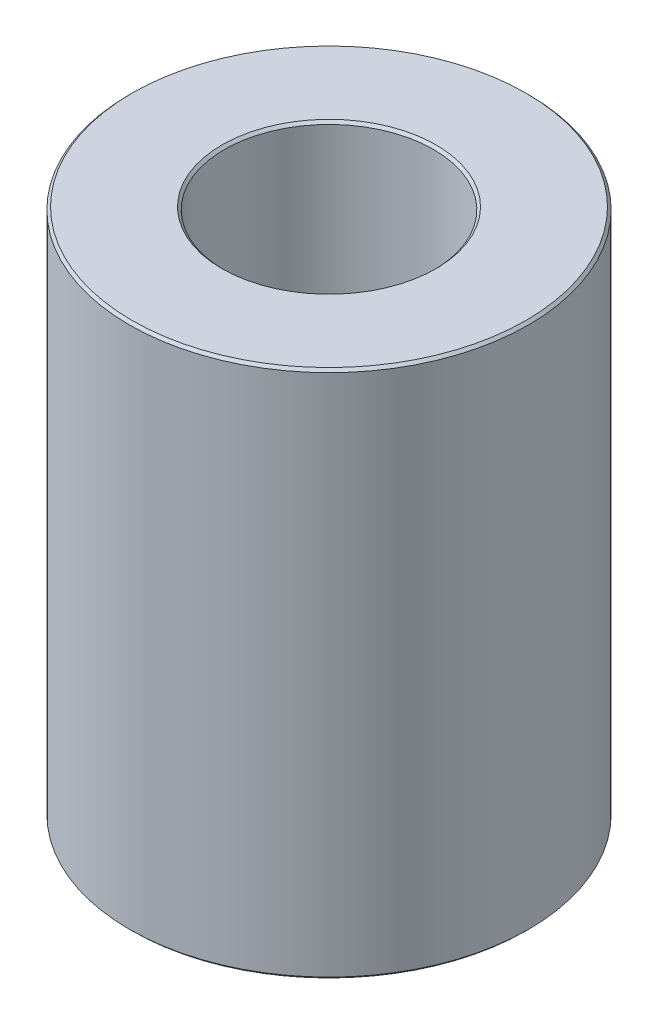
from build123d import *

# Parameters (mm, degrees)
SKETCH1_R           = 60
BOSS_EXTRUDE1_DEPTH = 158.984296112
SKETCH2_R           = 31.439176689
CUT_EXTRUDE1_DEPTH  = 181.211005241
CHAMFER1_SIZE       = 0.78153969


with BuildPart() as part:
    # Sketch1 → Boss-Extrude1 (new body)
    with BuildSketch(Plane(origin=(0, 0, 0), x_dir=(1, 0, 0), z_dir=(0, 1, 0))):
        Circle(SKETCH1_R)
    extrude(amount=BOSS_EXTRUDE1_DEPTH)

    # Sketch2 → Cut-Extrude1 (cut, through all)
    with BuildSketch(Plane(origin=(0, 0, 0), x_dir=(1, 0, 0), z_dir=(0, 1, 0))):
        Circle(SKETCH2_R)
    extrude(amount=CUT_EXTRUDE1_DEPTH, mode=Mode.SUBTRACT)

    # Chamfer1
    chamfer1_edges = [part.edges().sort_by_distance(p)[0] for p in [
        (-31.439176689, 158.984296112, 0),
        (-31.439176689, 0, 0),
        (-60, 0, 0),
        (-60, 158.984296112, 0),
    ]]
    chamfer(chamfer1_edges, length=CHAMFER1_SIZE)


solid = part.part
